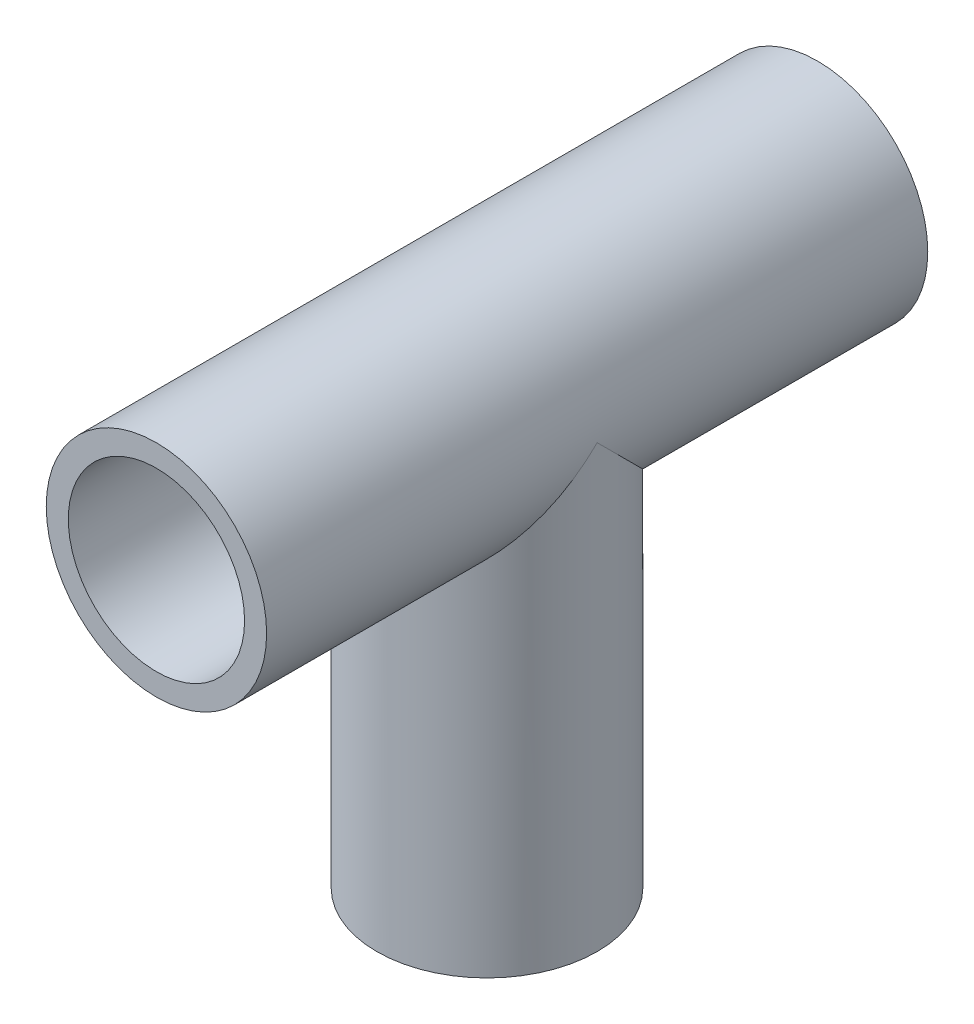
from build123d import *
from build123d.topology import SkipClean

# Parameters (mm, degrees)
SKETCH_2_R               = 2.5
SKETCH_2_R_2             = 2
EXTRUDE_1_DEPTH          = 10
EXTRUDE_2_DEPTH          = 7.5
EXTRUDE_2_DEPTH_BACK     = 7.5
SKETCH_3_R               = 2.5
SKETCH_3_R_2             = 2
SKETCH_4_R               = 2
CUT_EXTRUDE_1_DEPTH      = 20.685019761
CUT_EXTRUDE_3_REACH      = 16.79
CUT_EXTRUDE_3_END_RADIUS = 2
SKETCH_5_R               = 2


with BuildPart() as part:
    # 草图2 → 凸台-拉伸1 (new body)
    with BuildSketch(Plane(origin=(0, 0, 0), x_dir=(1, 0, 0), z_dir=(0, 1, 0))):
        Circle(SKETCH_2_R)
        Circle(SKETCH_2_R_2, mode=Mode.SUBTRACT)
    extrude(amount=EXTRUDE_1_DEPTH)

    # 草图3 → 凸台-拉伸2 (add, two sides: drawn at the far end of the back side and taken through both)
    with BuildSketch(Plane.XY.offset(-EXTRUDE_2_DEPTH_BACK)):
        with Locations((0, 10)):
            Circle(SKETCH_3_R)
        with Locations((0, 10)):
            Circle(SKETCH_3_R_2, mode=Mode.SUBTRACT)
    extrude(amount=EXTRUDE_2_DEPTH + EXTRUDE_2_DEPTH_BACK)

    # 草图4 → 切除-拉伸1 (cut, through all)
    with SkipClean():  # the faces are left unmerged after this step: merging them gives an invalid solid
        with BuildSketch(Plane.XY.offset(7.5)):
            with Locations((0, 10)):
                Circle(SKETCH_4_R)
        extrude(amount=-CUT_EXTRUDE_1_DEPTH, mode=Mode.SUBTRACT)

    # 切除-拉伸3: up to this cylinder (the profile starts outside it)
    with SkipClean():  # the faces are left unmerged after this step: merging them gives an invalid solid
        cut_extrude_3_end = Plane(origin=(0, 10, 0), z_dir=(0, 0, 1)) * Cylinder(CUT_EXTRUDE_3_END_RADIUS, 38.58, mode=Mode.PRIVATE)
        # 草图5 → 切除-拉伸3 (cut, up to the surface)
        with BuildSketch(Plane.XZ, mode=Mode.PRIVATE) as cut_extrude_3_sk1:
            Circle(SKETCH_5_R)
        cut_extrude_3_tool1 = extrude(cut_extrude_3_sk1.sketch, amount=-CUT_EXTRUDE_3_REACH, mode=Mode.PRIVATE) - cut_extrude_3_end
        add(cut_extrude_3_tool1.solids().sort_by_distance((0, 0, 0))[0], mode=Mode.SUBTRACT)


solid = part.part
